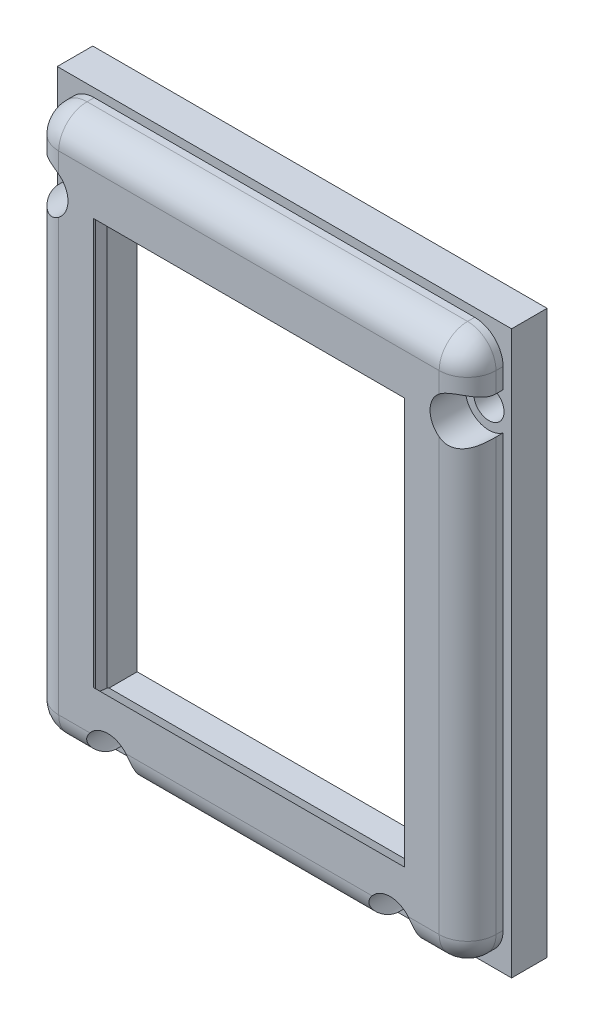
from build123d import *
from OCP.BRepFilletAPI import BRepFilletAPI_MakeChamfer

# Parameters (mm, degrees)
MODEL_W             = 40.64000000000001
MODEL_H             = 50.291999999999994
MODEL_R             = 1.3499999999999979
MODEL_R_2           = 1.3499999999999985
MODEL_R_3           = 1.3500000000000056
MODEL_R_4           = 1.3500000000000065
MODEL_W_2           = 32.69080000000003
MODEL_H_2           = 42.690799999999996
BOSS_EXTRUDE1_DEPTH = 3.175
SKETCH1_W           = 32.69080000000003
SKETCH1_H           = 42.690799999999996
SKETCH1_W_2         = 27.828239916797088
SKETCH1_H_2         = 36.340799999999994
BOSS_EXTRUDE2_DEPTH = 3.175
SKETCH2_W           = 39.116000000000014
SKETCH2_H           = 48.768
SKETCH2_W_2         = 32.69080000000003
SKETCH2_H_2         = 42.690799999999996
BOSS_EXTRUDE4_DEPTH = 3.175
FILLET1_R           = 2.54
FILLET2_R           = 2.54
CHAMFER9_SIZE       = 3.175
CHAMFER9_SIZE_2     = 2.858782841
CHAMFER10_SIZE      = 3.175
SKETCH4_R           = 1.3500000000000065
SKETCH4_R_2         = 1.3499999999999979
SKETCH4_R_3         = 1.3499999999999985
SKETCH4_R_4         = 1.3500000000000056
CUT_EXTRUDE1_DEPTH  = 100.03179502787644
CHAMFER11_SIZE      = 0.889
CHAMFER11_SIZE2     = 0.6602398251627483
CHAMFER12_SIZE      = 1.143
CHAMFER12_SIZE2     = 0.9523797142277386
CUT_EXTRUDE2_START  = -3.175
SKETCH5_R           = 2.0955000000000017
SKETCH5_R_2         = 2.095500000000001
CUT_EXTRUDE2_DEPTH  = 3.175


with BuildPart() as part:
    # Model → Boss-Extrude1 (new body)
    with BuildSketch(Plane.XY):
        with Locations((62.55399712221356, 28.695197306808385)):
            Rectangle(MODEL_W, MODEL_H)
        with Locations((44.272200000000005, 47.066199999999995)):
            Circle(MODEL_R, mode=Mode.SUBTRACT)
        with Locations((49.9364, 5.5118)):
            Circle(MODEL_R_2, mode=Mode.SUBTRACT)
        with Locations((75.184, 5.5118)):
            Circle(MODEL_R_3, mode=Mode.SUBTRACT)
        with Locations((80.84819999999999, 47.066199999999995)):
            Circle(MODEL_R_4, mode=Mode.SUBTRACT)
        with Locations((62.55399712221356, 28.69519730680839)):
            Rectangle(MODEL_W_2, MODEL_H_2, mode=Mode.SUBTRACT)
    extrude(amount=BOSS_EXTRUDE1_DEPTH)



with BuildPart() as body_2:
    # Sketch1 → Boss-Extrude2 (new body)
    with BuildSketch(Plane.XY.offset(3.175)):
        with Locations((62.55399712221356, 28.69519730680839)):
            Rectangle(SKETCH1_W, SKETCH1_H)
        with Locations((62.55399712221356, 28.695197306808385)):
            Rectangle(SKETCH1_W_2, SKETCH1_H_2, mode=Mode.SUBTRACT)
    extrude(amount=BOSS_EXTRUDE2_DEPTH)


with BuildPart() as part_1:
    add(part.part)

    add(body_2.part)  # Boss-Extrude4 merges body 2
    # Sketch2 → Boss-Extrude4 (add)
    with BuildSketch(Plane.XY.offset(3.175)):
        with Locations((62.55399712221356, 28.69519730680838)):
            Rectangle(SKETCH2_W, SKETCH2_H)
        with Locations((62.55399712221356, 28.69519730680839)):
            Rectangle(SKETCH2_W_2, SKETCH2_H_2, mode=Mode.SUBTRACT)
    extrude(amount=BOSS_EXTRUDE4_DEPTH)

    # Fillet1
    fillet1_edges = [part_1.edges().sort_by_distance(p)[0] for p in [
        (62.55399712221356, 4.311197306808385, 6.35),
        (62.55399712221356, 53.07919730680838, 6.35),
    ]]
    fillet(fillet1_edges, radius=FILLET1_R)

    # Fillet2
    fillet2_edges = [part_1.edges().sort_by_distance(p)[0] for p in [
        (82.11199712221357, 52.335248531022216, 5.6060512242138305),
        (82.11199712221357, 5.055146082594554, 5.606051224213831),
        (42.99599712221355, 4.311197306808385, 3.4924999999999997),
        (42.99599712221355, 53.07919730680838, 3.4924999999999997),
        (42.99599712221355, 52.33524853102221, 5.606051224213832),
        (42.99599712221355, 5.055146082594553, 5.6060512242138305),
        (42.99599712221355, 28.69519730680838, 6.35),
        (82.11199712221357, 28.695197306808385, 6.35),
        (82.11199712221357, 53.07919730680838, 3.4924999999999997),
        (82.11199712221357, 4.311197306808385, 3.4924999999999997),
    ]]
    fillet(fillet2_edges, radius=FILLET2_R)

    # Chamfer9
    # the kernel refuses this chamfer: 3.175, 2.858782841 mm, written as the material it takes off along each edge
    with BuildSketch(Plane(origin=(48.639877163815015, 46.86559730680839, 3.175), x_dir=(0, 0, 1), z_dir=(0, -1, 0))) as chamfer9_piece_1_section:
        Polygon((CHAMFER9_SIZE, 0), (0, CHAMFER9_SIZE_2), (0, 0), align=None)
    chamfer9_piece_1 = extrude(amount=36.3408, mode=Mode.PRIVATE)
    chamfer9_piece_1 = split(chamfer9_piece_1, bisect_by=Plane(origin=(46.20859712221354, 46.86559730680839, 3.175), z_dir=(1, 0, 0)), keep=Keep.TOP, mode=Mode.PRIVATE)
    add(chamfer9_piece_1, mode=Mode.SUBTRACT)
    with BuildSketch(Plane(origin=(76.4681170806121, 10.524797306808388, 3.175), x_dir=(0, 0, 1), z_dir=(0, 1, 0))) as chamfer9_piece_2_section:
        Polygon((CHAMFER9_SIZE, 0), (0, CHAMFER9_SIZE_2), (0, 0), align=None)
    chamfer9_piece_2 = extrude(amount=36.3408, mode=Mode.PRIVATE)
    chamfer9_piece_2 = split(chamfer9_piece_2, bisect_by=Plane(origin=(78.89939712221357, 10.524797306808388, 3.175), z_dir=(-1, 0, 0)), keep=Keep.TOP, mode=Mode.PRIVATE)
    add(chamfer9_piece_2, mode=Mode.SUBTRACT)

    # Chamfer10
    # the kernel refuses this chamfer: 3.175 mm, written as the material it takes off along each edge
    with BuildSketch(Plane(origin=(46.208597122214, 46.865597306808, 3.175), x_dir=(0, 1.2309e-13, 1), z_dir=(1, 0, 0))) as chamfer10_piece_1_section:
        Polygon((CHAMFER10_SIZE, 0), (3.908e-13, -CHAMFER10_SIZE), (0, 0), align=None)
    chamfer10_piece_1 = extrude(amount=32.690799999999996, mode=Mode.PRIVATE)
    chamfer10_piece_1 = split(chamfer10_piece_1, bisect_by=Plane(origin=(64.4986511687098, 46.865597306808, 19.643438635932224), z_dir=(-0.7431448254361507, 0, -0.6691306064046639)), keep=Keep.TOP, mode=Mode.PRIVATE)
    chamfer10_piece_1 = split(chamfer10_piece_1, bisect_by=Plane(origin=(45.97250261720881, 46.865597306808, 3.387580447169522), z_dir=(0.7431448254361507, 0, -0.6691306064046639)), keep=Keep.TOP, mode=Mode.PRIVATE)
    add(chamfer10_piece_1, mode=Mode.SUBTRACT)
    with BuildSketch(Plane(origin=(78.899397122214, 10.524797306808, 3.175), x_dir=(1.1e-16, -1, 0), z_dir=(-1, -1.1e-16, 0))) as chamfer10_piece_2_section:
        Polygon((CHAMFER10_SIZE, 0), (-3.908e-13, CHAMFER10_SIZE), (0, 0), align=None)
    chamfer10_piece_2 = extrude(amount=32.690799999999996, mode=Mode.PRIVATE)
    chamfer10_piece_2 = split(chamfer10_piece_2, bisect_by=Plane(origin=(79.13549162721864, 10.524797306808, 3.38758044716903), z_dir=(-0.7431448254361507, 0, -0.6691306064046639)), keep=Keep.TOP, mode=Mode.PRIVATE)
    chamfer10_piece_2 = split(chamfer10_piece_2, bisect_by=Plane(origin=(60.609343075717646, 10.524797306808, 19.64343863593272), z_dir=(0.7431448254361507, 0, -0.6691306064046639)), keep=Keep.TOP, mode=Mode.PRIVATE)
    add(chamfer10_piece_2, mode=Mode.SUBTRACT)

    # Sketch4 → Cut-Extrude1 (cut, through all)
    with BuildSketch(Plane(origin=(0, 0, 0), x_dir=(-1, 0, 0), z_dir=(0, 0, -1))):
        with Locations(Location((-80.84819999999999, 47.066199999999995, 0), (0, 0, 19.032198816))):
            Circle(SKETCH4_R)
        with Locations(Location((-44.272200000000005, 47.066199999999995, 0), (0, 0, 19.032198816))):
            Circle(SKETCH4_R_2)
        with Locations(Location((-49.9364, 5.5118, 0), (0, 0, 297.210156983))):
            Circle(SKETCH4_R_3)
        with Locations(Location((-75.184, 5.5118, 0), (0, 0, 297.210156983))):
            Circle(SKETCH4_R_4)
    extrude(amount=-CUT_EXTRUDE1_DEPTH, mode=Mode.SUBTRACT)

    # Chamfer11: one chamfer whose edges measure the first distance from different faces: ONE call of the kernel's chamfer builder (chamfer() names one face for all edges)
    chamfer11_edges_1 = [part_1.edges().sort_by_distance(p)[0] for p in [
        (62.55399712221356, 50.04059730680839, 3.175),
    ]]
    chamfer11_side_1 = [part_1.faces().sort_by_distance(p)[0] for p in [
        (62.55399712221734, 48.49951336002211, 4.716083946785889),
    ]]
    chamfer11_edges_2 = [part_1.edges().sort_by_distance(p)[0] for p in [
        (62.55399712221356, 7.349797306808389, 3.175),
    ]]
    chamfer11_side_2 = [part_1.faces().sort_by_distance(p)[0] for p in [
        (62.553997122213964, 8.890881253594266, 4.716083946786265),
    ]]
    chamfer11 = BRepFilletAPI_MakeChamfer(part_1.part.solid().wrapped)
    for e in chamfer11_edges_1:
        chamfer11.Add(CHAMFER11_SIZE, CHAMFER11_SIZE2, e.wrapped, chamfer11_side_1[0].wrapped)  # the first distance lies on this face
    for e in chamfer11_edges_2:
        chamfer11.Add(CHAMFER11_SIZE, CHAMFER11_SIZE2, e.wrapped, chamfer11_side_2[0].wrapped)  # the first distance lies on this face
    add(Compound.cast(chamfer11.Shape()), mode=Mode.REPLACE)

    # Chamfer12: one chamfer whose edges measure the first distance from different faces: ONE call of the kernel's chamfer builder (chamfer() names one face for all edges)
    chamfer12_edges_1 = [part_1.edges().sort_by_distance(p)[0] for p in [
        (46.208597122213995, 28.695197306810893, 3.6497899590838045),
    ]]
    chamfer12_side_1 = [part_1.faces().sort_by_distance(p)[0] for p in [
        (47.396342466238764, 28.695197306818734, 4.9689148024186895),
    ]]
    chamfer12_edges_2 = [part_1.edges().sort_by_distance(p)[0] for p in [
        (78.899397122214, 28.695197306805508, 3.6497899590828133),
    ]]
    chamfer12_side_2 = [part_1.faces().sort_by_distance(p)[0] for p in [
        (77.71165177818875, 28.695197306797276, 4.96891480241812),
    ]]
    chamfer12 = BRepFilletAPI_MakeChamfer(part_1.part.solid().wrapped)
    for e in chamfer12_edges_1:
        chamfer12.Add(CHAMFER12_SIZE, CHAMFER12_SIZE2, e.wrapped, chamfer12_side_1[0].wrapped)  # the first distance lies on this face
    for e in chamfer12_edges_2:
        chamfer12.Add(CHAMFER12_SIZE, CHAMFER12_SIZE2, e.wrapped, chamfer12_side_2[0].wrapped)  # the first distance lies on this face
    add(Compound.cast(chamfer12.Shape()), mode=Mode.REPLACE)

    # Sketch5 → Cut-Extrude2 (cut)
    with BuildSketch(Plane.XY.offset(6.35).offset(CUT_EXTRUDE2_START)):
        with Locations((44.272200000000005, 47.066199999999995)):
            Circle(SKETCH5_R)
        with Locations((80.84819999999999, 47.066199999999995)):
            Circle(SKETCH5_R)
        with Locations((75.184, 5.5118)):
            Circle(SKETCH5_R_2)
        with Locations((49.9364, 5.5118)):
            Circle(SKETCH5_R_2)
    extrude(amount=CUT_EXTRUDE2_DEPTH, mode=Mode.SUBTRACT)


solid = part_1.part
